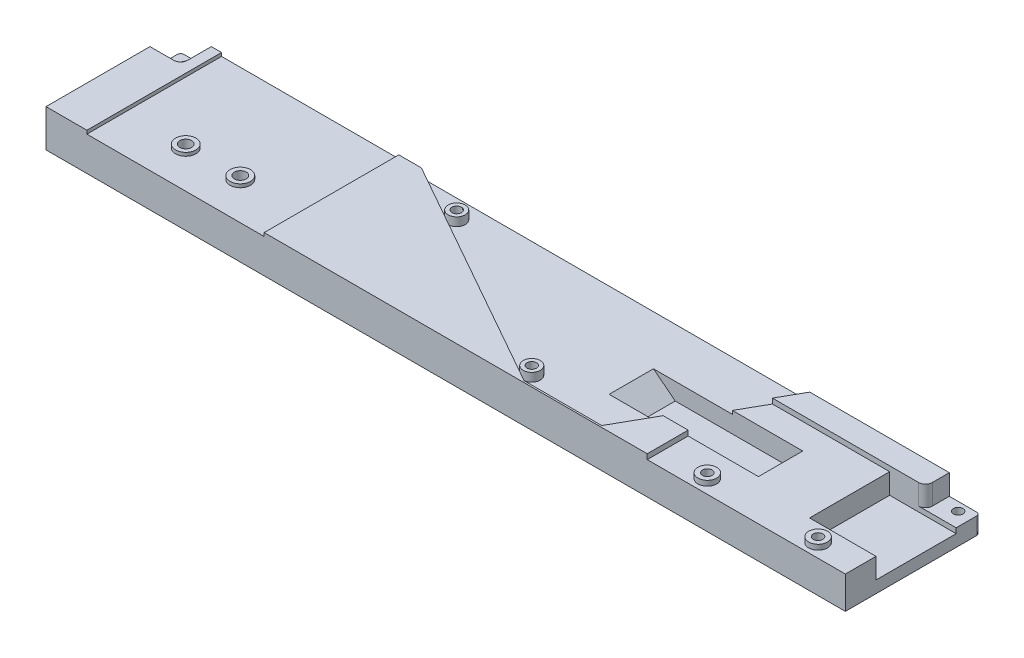
from build123d import *

# Parameters (mm, degrees)
SKETCH_1_W           = 234.5
SKETCH_1_H           = 39.5
EXTRUDE_1_DEPTH      = 11
SKETCH_2_W           = 9
SKETCH_2_H           = 9
SKETCH_2_H_2         = 7
CUT_EXTRUDE_1_DEPTH  = 6
FILLET_2_R           = 2
SKETCH_3_R           = 1.4
CUT_EXTRUDE_2_DEPTH  = 6
FILLET_5_R           = 1
SKETCH_4_R           = 1.4
CUT_EXTRUDE_3_DEPTH  = 30
SKETCH_6_W           = 19.5
SKETCH_6_H           = 23.5
CUT_EXTRUDE_4_DEPTH  = 7.5
FILLET_7_R           = 2
SKETCH_7_W           = 37
SKETCH_7_H           = 13
CUT_EXTRUDE_5_DEPTH  = 7.5
CHAMFER_1_SIZE       = 10
CHAMFER_1_SIZE_2     = 7.812856265
SKETCH_8_R           = 1.4
CUT_EXTRUDE_6_DEPTH  = 37.5
CUT_EXTRUDE_8_DEPTH  = 2.5
SKETCH_10_R          = 1.75
CUT_EXTRUDE_9_DEPTH  = 13.5
SKETCH_11_W          = 52
SKETCH_11_H          = 48
CUT_EXTRUDE_10_DEPTH = 1
EXTRUDE_START        = 1
SKETCH_12_R          = 3
SKETCH_12_R_2        = 1.75
EXTRUDE_2_DEPTH      = 1
EXTRUDE_START_2      = 2.5
SKETCH_13_R          = 2.5
SKETCH_13_R_2        = 1.4
EXTRUDE_3_DEPTH      = 2.5
SKETCH_14_W          = 58.122310869
SKETCH_14_H          = 32.5
CUT_EXTRUDE_11_DEPTH = 1.5
EXTRUDE_START_3      = 1.5
SKETCH_15_R          = 2.75
SKETCH_15_R_2        = 1.4
EXTRUDE_4_DEPTH      = 1.5
CUT_EXTRUDE_12_DEPTH = 2.5


# Some blends are built 0.0001 mm under size
with BuildPart() as part:
    # 草图1 → 凸台-拉伸1 (new body)
    with BuildSketch(Plane(origin=(0, 0, 0), x_dir=(1, 0, 0), z_dir=(0, 1, 0))):
        with Locations((100.761595342, -12.674606198)):
            Rectangle(SKETCH_1_W, SKETCH_1_H)
    extrude(amount=EXTRUDE_1_DEPTH)

    # 草图2 → 切除-拉伸1 (cut)
    with BuildSketch(Plane(origin=(0, 11, 0), x_dir=(1, 0, 0), z_dir=(0, 1, 0))):
        with Locations((-11.988404658, 2.575393802)):
            Rectangle(SKETCH_2_W, SKETCH_2_H)
        with Locations((213.511595342, 3.575393802)):
            Rectangle(SKETCH_2_W, SKETCH_2_H_2)
    extrude(amount=-CUT_EXTRUDE_1_DEPTH, mode=Mode.SUBTRACT)

    # 圆角2
    fillet_2_edges = [part.edges().sort_by_distance(p)[0] for p in [
        (-7.488404658, 8, 1.924606198),
        (209.011595342, 8, -0.075393802),
    ]]
    fillet(fillet_2_edges, radius=FILLET_2_R)

    # 草图3 → 切除-拉伸2 (cut)
    with BuildSketch(Plane(origin=(0, 5, 0), x_dir=(1, 0, 0), z_dir=(0, 1, 0))):
        with Locations(Location((214.111595342, 4.575393802, 0), (0, 0, 270))):
            Circle(SKETCH_3_R)
        with Locations(Location((-12.588404658, 4.575393802, 0), (0, 0, 270))):
            Circle(SKETCH_3_R)
    extrude(amount=-CUT_EXTRUDE_2_DEPTH, mode=Mode.SUBTRACT)

    # 圆角5
    fillet_5_edges = [part.edges().sort_by_distance(p)[0] for p in [
        (-16.488404658, 2.5, -7.075393802),
        (218.011595342, 2.5, -7.075393802),
    ]]
    fillet(fillet_5_edges, radius=FILLET_5_R)

    # 草图4 → 切除-拉伸3 (cut)
    with BuildSketch(Plane(origin=(0, 11, 0), x_dir=(1, 0, 0), z_dir=(0, 1, 0))):
        with Locations(Location((206.011595342, -28.424606198, 0), (0, 0, 270))):
            Circle(SKETCH_4_R)
        with Locations(Location((173.511595342, -28.424606198, 0), (0, 0, 270))):
            Circle(SKETCH_4_R)
    extrude(amount=-CUT_EXTRUDE_3_DEPTH, mode=Mode.SUBTRACT)

    # 草图6 → 切除-拉伸4 (cut)
    with BuildSketch(Plane(origin=(0, 11, 0), x_dir=(1, 0, 0), z_dir=(0, 1, 0))):
        with Locations((208.261595342, -11.674606198)):
            Rectangle(SKETCH_6_W, SKETCH_6_H)
    extrude(amount=-CUT_EXTRUDE_4_DEPTH, mode=Mode.SUBTRACT)

    # 圆角7
    fillet_7_edges = [part.edges().sort_by_distance(p)[0] for p in [
        (211.011595342, 8, -0.075393802),
    ]]
    fillet(fillet_7_edges, radius=FILLET_7_R - 0.0001)  # a hair under: the kernel refuses the full size

    # 草图7 → 切除-拉伸5 (cut)
    with BuildSketch(Plane(origin=(0, 11, 0), x_dir=(1, 0, 0), z_dir=(0, 1, 0))):
        with Locations((162.011595342, -13.924606198)):
            Rectangle(SKETCH_7_W, SKETCH_7_H)
    extrude(amount=-CUT_EXTRUDE_5_DEPTH, mode=Mode.SUBTRACT)

    # 倒角1
    # the kernel refuses this chamfer: 10, 7.812856265 mm, written as the material it takes off along each edge
    with BuildSketch(Plane(origin=(143.511595342, 11, 20.424606198), x_dir=(-0.9997151392093143, 0.023867141339117017, 0), z_dir=(0, 0, -1))) as chamfer_1_piece_1_section:
        Polygon((CHAMFER_1_SIZE * 0.999715139209, -CHAMFER_1_SIZE * 0.0238671413391), (-CHAMFER_1_SIZE_2 * 0.0238671413393, -CHAMFER_1_SIZE_2 * 0.999715139218), (0, 0), align=None)
    chamfer_1_piece_1 = extrude(amount=13, mode=Mode.PRIVATE)
    chamfer_1_piece_1 = split(chamfer_1_piece_1, bisect_by=Plane(origin=(140.173122789, 3.5, 13.924606198), z_dir=(0, 1, 0)), keep=Keep.TOP, mode=Mode.PRIVATE)
    add(chamfer_1_piece_1, mode=Mode.SUBTRACT)

    # 草图8 → 切除-拉伸6 (cut)
    with BuildSketch(Plane(origin=(0, 11, 0), x_dir=(1, 0, 0), z_dir=(0, 1, 0))):
        with Locations(Location((120.511595342, -26.924606198, 0), (0, 0, 270))):
            Circle(SKETCH_8_R)
        with Locations(Location((69.99674604, 1.575393802, 0), (0, 0, 270))):
            Circle(SKETCH_8_R)
    extrude(amount=-CUT_EXTRUDE_6_DEPTH, mode=Mode.SUBTRACT)

    # 草图9 → 切除-拉伸8 (cut)
    with BuildSketch(Plane(origin=(0, 11, 0), x_dir=(1, 0, 0), z_dir=(0, 1, 0))):
        Polygon((51.103694557, 8.790142976), (123.268586448, -31.924606198), (150.036795822, 15.520729333), (77.871903931, 56.235478507), align=None)
    extrude(amount=-CUT_EXTRUDE_8_DEPTH, mode=Mode.SUBTRACT)

    # 草图10 → 切除-拉伸9 (cut)
    with BuildSketch(Plane(origin=(0, 11, 0), x_dir=(1, 0, 0), z_dir=(0, 1, 0))):
        with Locations(Location((13.511595342, -21.424606198, 0), (0, 0, 270))):
            Circle(SKETCH_10_R)
        with Locations(Location((29.511595342, -21.424606198, 0), (0, 0, 270))):
            Circle(SKETCH_10_R)
    extrude(amount=-CUT_EXTRUDE_9_DEPTH, mode=Mode.SUBTRACT)

    # 草图11 → 切除-拉伸10 (cut)
    with BuildSketch(Plane(origin=(0, 11, 0), x_dir=(1, 0, 0), z_dir=(0, 1, 0))):
        with Locations((21.511595342, -8.424606198)):
            Rectangle(SKETCH_11_W, SKETCH_11_H)
    extrude(amount=-CUT_EXTRUDE_10_DEPTH, mode=Mode.SUBTRACT)

    # 草图12 → 凸台-拉伸2 (add)
    # profile 1 of 2: a face of its own
    with BuildSketch(Plane(origin=(0, 10, 0), x_dir=(1, 0, 0), z_dir=(0, 1, 0)).offset(EXTRUDE_START)):
        with Locations(Location((13.511595342, -21.424606198, 0), (0, 0, 270))):
            Circle(SKETCH_12_R)
        with Locations(Location((13.511595342, -21.424606198, 0), (0, 0, 270))):
            Circle(SKETCH_12_R_2, mode=Mode.SUBTRACT)
    # profile 2 of 2: a face of its own
    with BuildSketch(Plane(origin=(0, 10, 0), x_dir=(1, 0, 0), z_dir=(0, 1, 0)).offset(EXTRUDE_START)):
        with Locations(Location((29.511595342, -21.424606198, 0), (0, 0, 270))):
            Circle(SKETCH_12_R)
        with Locations(Location((29.511595342, -21.424606198, 0), (0, 0, 270))):
            Circle(SKETCH_12_R_2, mode=Mode.SUBTRACT)
    extrude(amount=-EXTRUDE_2_DEPTH)

    # 草图13 → 凸台-拉伸3 (add)
    # profile 1 of 2: a face of its own
    with BuildSketch(Plane(origin=(0, 8.5, 0), x_dir=(1, 0, 0), z_dir=(0, 1, 0)).offset(EXTRUDE_START_2)):
        with Locations(Location((69.99674604, 1.575393802, 0), (0, 0, 270))):
            Circle(SKETCH_13_R)
        with Locations(Location((69.99674604, 1.575393802, 0), (0, 0, 270))):
            Circle(SKETCH_13_R_2, mode=Mode.SUBTRACT)
    # profile 2 of 2: a face of its own
    with BuildSketch(Plane(origin=(0, 8.5, 0), x_dir=(1, 0, 0), z_dir=(0, 1, 0)).offset(EXTRUDE_START_2)):
        with Locations(Location((120.511595342, -26.924606198, 0), (0, 0, 270))):
            Circle(SKETCH_13_R)
        with Locations(Location((120.511595342, -26.924606198, 0), (0, 0, 270))):
            Circle(SKETCH_13_R_2, mode=Mode.SUBTRACT)
    extrude(amount=-EXTRUDE_3_DEPTH)

    # 草图14 → 切除-拉伸11 (cut)
    with BuildSketch(Plane(origin=(0, 11, 0), x_dir=(1, 0, 0), z_dir=(0, 1, 0))):
        with Locations((188.950439908, -16.174606198)):
            Rectangle(SKETCH_14_W, SKETCH_14_H)
    extrude(amount=-CUT_EXTRUDE_11_DEPTH, mode=Mode.SUBTRACT)

    # 草图15 → 凸台-拉伸4 (add)
    # profile 1 of 2: a face of its own
    with BuildSketch(Plane(origin=(0, 9.5, 0), x_dir=(1, 0, 0), z_dir=(0, 1, 0)).offset(EXTRUDE_START_3)):
        with Locations(Location((173.511595342, -28.424606198, 0), (0, 0, 270))):
            Circle(SKETCH_15_R)
        with Locations(Location((173.511595342, -28.424606198, 0), (0, 0, 270))):
            Circle(SKETCH_15_R_2, mode=Mode.SUBTRACT)
    # profile 2 of 2: a face of its own
    with BuildSketch(Plane(origin=(0, 9.5, 0), x_dir=(1, 0, 0), z_dir=(0, 1, 0)).offset(EXTRUDE_START_3)):
        with Locations(Location((206.011595342, -28.424606198, 0), (0, 0, 270))):
            Circle(SKETCH_15_R)
        with Locations(Location((206.011595342, -28.424606198, 0), (0, 0, 270))):
            Circle(SKETCH_15_R_2, mode=Mode.SUBTRACT)
    extrude(amount=-EXTRUDE_4_DEPTH)

    # 草图16 → 切除-拉伸12 (cut)
    with BuildSketch(Plane(origin=(0, 11, 0), x_dir=(1, 0, 0), z_dir=(0, 1, 0))):
        Polygon((123.268586448, -31.924606198), (146.066616294, -31.924606198), (168.070047273, 7.075393802), (145.272017426, 7.075393802), align=None)
    extrude(amount=-CUT_EXTRUDE_12_DEPTH, mode=Mode.SUBTRACT)


solid = part.part
